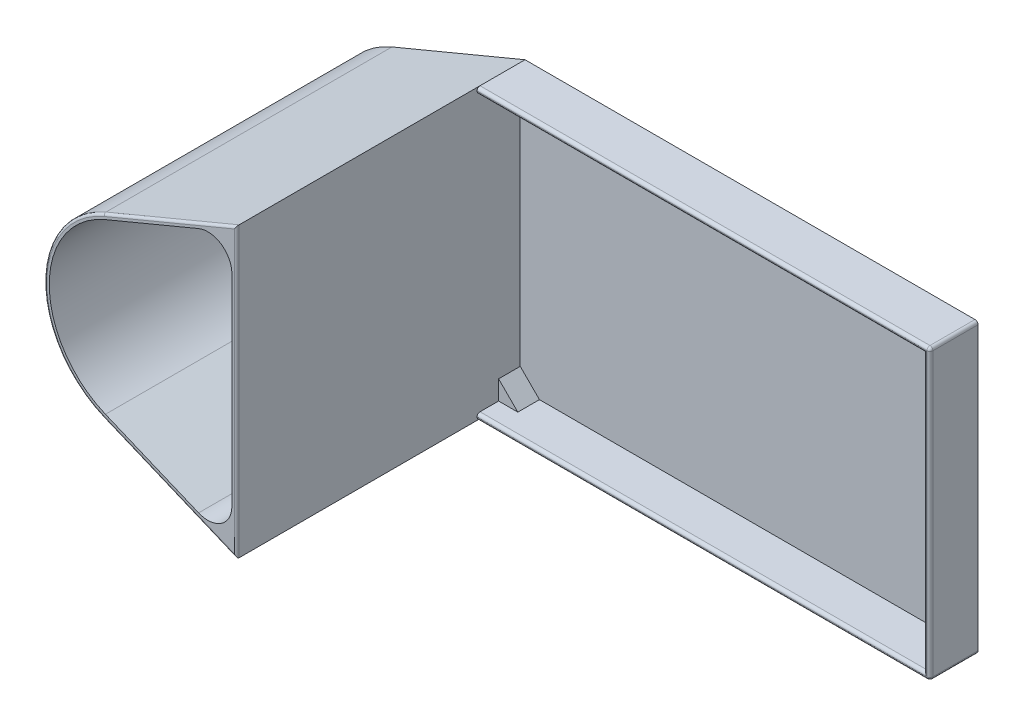
from build123d import *

# Parameters (mm, degrees)
SZKIC1_W                    = 95.25
SZKIC1_H                    = 60
DODANIE_WYCI_GNI_CIE1_DEPTH = 10
SZKIC2_W                    = 93
SZKIC2_H                    = 57.5
WYTNIJ_WYCI_GNI_CIE1_DEPTH  = 9
DODANIE_WYCI_GNI_CIE3_DEPTH = 60
WYTNIJ_WYCI_GNI_CIE2_REACH  = 106.318
DODANIE_WYCI_GNI_CIE4_DEPTH = 1
ZAOKR_GLENIE1_R             = 0.63
ZAOKR_GLENIE2_R             = 5
ZAOKR_GLENIE3_R             = 0.5
DODANIE_WYCI_GNI_CIE2_DEPTH = 4.5
ZAOKR_GLENIE4_R             = 4


with BuildPart() as part:
    # Szkic1 → Dodanie-wyciągnięcie1 (new body)
    with BuildSketch(Plane.XY):
        with Locations((0.125, 0)):
            Rectangle(SZKIC1_W, SZKIC1_H)
    extrude(amount=DODANIE_WYCI_GNI_CIE1_DEPTH)

    # Szkic2 → Wytnij-wyciągnięcie1 (cut)
    with BuildSketch(Plane.XY.offset(10)):
        Rectangle(SZKIC2_W, SZKIC2_H)
    extrude(amount=-WYTNIJ_WYCI_GNI_CIE1_DEPTH, mode=Mode.SUBTRACT)

    # Szkic4 → Dodanie-wyciągnięcie3 (add)
    with BuildSketch(Plane.XY):
        with BuildLine():
            Line((-46.5, -30), (-74.192307692, -18.461538462))
            ThreePointArc((-74.192307692, -18.461538462), (-86.5, 0), (-74.192307692, 18.461538462))
            Line((-74.192307692, 18.461538462), (-46.5, 30))
            Line((-46.5, 30), (-46.5, -30))
        make_face()
        with BuildLine():
            Line((-47.5, -28.5), (-73.807692308, -17.538461538))
            ThreePointArc((-73.807692308, -17.538461538), (-85.5, 0), (-73.807692308, 17.538461538))
            Line((-73.807692308, 17.538461538), (-47.5, 28.5))
            Line((-47.5, 28.5), (-47.5, -28.5))
        make_face(mode=Mode.SUBTRACT)
    extrude(amount=DODANIE_WYCI_GNI_CIE3_DEPTH)

    # Szkic6 → Wytnij-wyciągnięcie2 (cut, up to next)
    with BuildSketch(Plane.XY.offset(10), mode=Mode.PRIVATE) as wytnij_wyci_gni_cie2_sk1:
        Polygon((-46.5, -30), (-47.5, -29.583333333), (-47.5, -30), align=None)
    wytnij_wyci_gni_cie2_tool1 = extrude(wytnij_wyci_gni_cie2_sk1.sketch, amount=-WYTNIJ_WYCI_GNI_CIE2_REACH, mode=Mode.PRIVATE) & part.part
    # Szkic6 → Wytnij-wyciągnięcie2 (cut, up to next)
    with BuildSketch(Plane.XY.offset(10), mode=Mode.PRIVATE) as wytnij_wyci_gni_cie2_sk2:
        Polygon((-46.5, 30), (-47.5, 29.583333333), (-47.5, 30), align=None)
    wytnij_wyci_gni_cie2_tool2 = extrude(wytnij_wyci_gni_cie2_sk2.sketch, amount=-WYTNIJ_WYCI_GNI_CIE2_REACH, mode=Mode.PRIVATE) & part.part
    add(wytnij_wyci_gni_cie2_tool1.solids().sort_by_distance((-47.166667, -29.861111, 10))[0], mode=Mode.SUBTRACT)
    add(wytnij_wyci_gni_cie2_tool2.solids().sort_by_distance((-47.166667, 29.861111, 10))[0], mode=Mode.SUBTRACT)

    # Szkic5 → Dodanie-wyciągnięcie4 (add)
    with BuildSketch(Plane(origin=(0, 0, 0), x_dir=(-1, 0, 0), z_dir=(0, 0, -1))):
        with BuildLine():
            Line((73.807692308, -17.538461538), (47.5, -28.5))
            Line((47.5, -28.5), (47.5, 28.5))
            Line((47.5, 28.5), (73.807692308, 17.538461538))
            ThreePointArc((73.807692308, 17.538461538), (85.5, 0), (73.807692308, -17.538461538))
        make_face()
    extrude(amount=-DODANIE_WYCI_GNI_CIE4_DEPTH)

    # Zaokrąglenie1
    # the kernel refuses this fillet: 0.63 mm, written as the material it takes off along each edge
    with BuildSketch(Plane(origin=(47.12, 29.37, 9.37), x_dir=(1, 0, 0), z_dir=(0, 1, 0))) as zaokr_glenie1_piece_1_section:
        Polygon((0, 0), (ZAOKR_GLENIE1_R * 1.02, 0), (ZAOKR_GLENIE1_R * 1.02, -ZAOKR_GLENIE1_R * 1.02), (0, -ZAOKR_GLENIE1_R * 1.02), align=None)
    zaokr_glenie1_piece_1 = extrude(amount=ZAOKR_GLENIE1_R * 1.02, mode=Mode.PRIVATE)
    zaokr_glenie1_piece_1 = zaokr_glenie1_piece_1 - Plane(origin=(47.12, 29.37, 9.37), x_dir=(-0.7071067811865475, 0, -0.7071067811865475), z_dir=(0, 1, 0)) * Sphere(ZAOKR_GLENIE1_R, mode=Mode.PRIVATE)
    add(zaokr_glenie1_piece_1, mode=Mode.SUBTRACT)
    with BuildSketch(Plane(origin=(47.12, -29.37, 9.37), x_dir=(0, 0, 1), z_dir=(1, 0, 0))) as zaokr_glenie1_piece_2_section:
        Polygon((0, 0), (ZAOKR_GLENIE1_R * 1.02, 0), (ZAOKR_GLENIE1_R * 1.02, ZAOKR_GLENIE1_R * 1.02), (0, ZAOKR_GLENIE1_R * 1.02), align=None)
    zaokr_glenie1_piece_2 = extrude(amount=ZAOKR_GLENIE1_R * 1.02, mode=Mode.PRIVATE)
    zaokr_glenie1_piece_2 = zaokr_glenie1_piece_2 - Plane(origin=(47.12, -29.37, 9.37), x_dir=(0, 0.7071067811865475, -0.7071067811865475), z_dir=(1, 0, 0)) * Sphere(ZAOKR_GLENIE1_R, mode=Mode.PRIVATE)
    add(zaokr_glenie1_piece_2, mode=Mode.SUBTRACT)
    with BuildSketch(Plane(origin=(47.75, 30, -1.575), x_dir=(-1, 0, 0), z_dir=(0, 0, 1)), Plane(origin=(47.75, -30, -1.575), x_dir=(0, 1, 0), z_dir=(0, 0, 1))) as zaokr_glenie1_piece_3:
        with BuildLine():
            CenterArc((ZAOKR_GLENIE1_R, ZAOKR_GLENIE1_R), ZAOKR_GLENIE1_R, 180, 90)
            Line((0, ZAOKR_GLENIE1_R), (0, 0))
            Line((0, 0), (ZAOKR_GLENIE1_R, 0))
        make_face()
    extrude(amount=10.945, mode=Mode.SUBTRACT)
    with BuildSketch(Plane(origin=(-46.5, 30, 10), x_dir=(0, 0, -1), z_dir=(1, 0, 0))) as zaokr_glenie1_piece_4:
        with BuildLine():
            CenterArc((ZAOKR_GLENIE1_R, -ZAOKR_GLENIE1_R), ZAOKR_GLENIE1_R, 90, 90)
            Line((0, -ZAOKR_GLENIE1_R), (0, 0))
            Line((0, 0), (ZAOKR_GLENIE1_R, 0))
        make_face()
    extrude(amount=93.62, mode=Mode.SUBTRACT)
    with BuildSketch(Plane(origin=(47.75, 29.37, 10), x_dir=(0, 0, -1), z_dir=(0, -1, 0))) as zaokr_glenie1_piece_5:
        with BuildLine():
            CenterArc((ZAOKR_GLENIE1_R, -ZAOKR_GLENIE1_R), ZAOKR_GLENIE1_R, 90, 90)
            Line((0, -ZAOKR_GLENIE1_R), (0, 0))
            Line((0, 0), (ZAOKR_GLENIE1_R, 0))
        make_face()
    extrude(amount=58.74, mode=Mode.SUBTRACT)
    with BuildSketch(Plane(origin=(47.12, -30, 10), x_dir=(0, 1, 0), z_dir=(-1, 0, 0))) as zaokr_glenie1_piece_6:
        with BuildLine():
            CenterArc((ZAOKR_GLENIE1_R, ZAOKR_GLENIE1_R), ZAOKR_GLENIE1_R, 180, 90)
            Line((0, ZAOKR_GLENIE1_R), (0, 0))
            Line((0, 0), (ZAOKR_GLENIE1_R, 0))
        make_face()
    extrude(amount=93.62, mode=Mode.SUBTRACT)
    with BuildSketch(Plane(origin=(46.5, 28.75, 10), x_dir=(1, 0, 0), z_dir=(0, -1, 0))) as zaokr_glenie1_piece_7:
        with BuildLine():
            CenterArc((ZAOKR_GLENIE1_R, -ZAOKR_GLENIE1_R), ZAOKR_GLENIE1_R, 90, 90)
            Line((0, -ZAOKR_GLENIE1_R), (0, 0))
            Line((0, 0), (ZAOKR_GLENIE1_R, 0))
        make_face()
    extrude(amount=57.5, mode=Mode.SUBTRACT)
    with BuildSketch(Plane(origin=(-46.5, 28.75, 10), x_dir=(0, 1, 0), z_dir=(1, 0, 0)), Plane(origin=(46.5, -28.75, 10), x_dir=(0, -1, 0), z_dir=(-1, 0, 0))) as zaokr_glenie1_piece_8:
        with BuildLine():
            CenterArc((ZAOKR_GLENIE1_R, -ZAOKR_GLENIE1_R), ZAOKR_GLENIE1_R, 90, 90)
            Line((0, -ZAOKR_GLENIE1_R), (0, 0))
            Line((0, 0), (ZAOKR_GLENIE1_R, 0))
        make_face()
    extrude(amount=93, mode=Mode.SUBTRACT)
    with BuildSketch(Plane(origin=(-46.5, 28.75, 10), x_dir=(0, 1, 0), z_dir=(1, 0, 0))) as zaokr_glenie1_piece_9a_section:
        with BuildLine():
            CenterArc((ZAOKR_GLENIE1_R, -ZAOKR_GLENIE1_R), ZAOKR_GLENIE1_R, 90, 90)
            Line((0, -ZAOKR_GLENIE1_R), (0, 0))
            Line((0, 0), (ZAOKR_GLENIE1_R, 0))
        make_face()
    zaokr_glenie1_piece_9a = extrude(amount=94.575, mode=Mode.PRIVATE)
    zaokr_glenie1_piece_9a = split(zaokr_glenie1_piece_9a, bisect_by=Plane(origin=(47.75, 28.75, 10), z_dir=(-1, 0, 0)), keep=Keep.TOP, mode=Mode.PRIVATE)
    zaokr_glenie1_piece_9a = split(zaokr_glenie1_piece_9a, bisect_by=Plane(origin=(46.5, 28.75, 10), z_dir=(1, 0, 0)), keep=Keep.TOP, mode=Mode.PRIVATE)
    with BuildSketch(Plane(origin=(46.5, 30.325, 10), x_dir=(1, 0, 0), z_dir=(0, -1, 0))) as zaokr_glenie1_piece_9b_section:
        with BuildLine():
            CenterArc((ZAOKR_GLENIE1_R, -ZAOKR_GLENIE1_R), ZAOKR_GLENIE1_R, 90, 90)
            Line((0, -ZAOKR_GLENIE1_R), (0, 0))
            Line((0, 0), (ZAOKR_GLENIE1_R, 0))
        make_face()
    zaokr_glenie1_piece_9b = extrude(amount=59.075, mode=Mode.PRIVATE)
    zaokr_glenie1_piece_9b = split(zaokr_glenie1_piece_9b, bisect_by=Plane(origin=(46.5, 30, 10), z_dir=(0, -1, 0)), keep=Keep.TOP, mode=Mode.PRIVATE)
    zaokr_glenie1_piece_9b = split(zaokr_glenie1_piece_9b, bisect_by=Plane(origin=(46.5, 28.75, 10), z_dir=(0, 1, 0)), keep=Keep.TOP, mode=Mode.PRIVATE)
    zaokr_glenie1_piece_9 = zaokr_glenie1_piece_9a & zaokr_glenie1_piece_9b
    add(zaokr_glenie1_piece_9, mode=Mode.SUBTRACT)
    with BuildSketch(Plane(origin=(46.5, 28.75, 10), x_dir=(1, 0, 0), z_dir=(0, -1, 0))) as zaokr_glenie1_piece_10a_section:
        with BuildLine():
            CenterArc((ZAOKR_GLENIE1_R, -ZAOKR_GLENIE1_R), ZAOKR_GLENIE1_R, 90, 90)
            Line((0, -ZAOKR_GLENIE1_R), (0, 0))
            Line((0, 0), (ZAOKR_GLENIE1_R, 0))
        make_face()
    zaokr_glenie1_piece_10a = extrude(amount=59.075, mode=Mode.PRIVATE)
    zaokr_glenie1_piece_10a = split(zaokr_glenie1_piece_10a, bisect_by=Plane(origin=(46.5, -30, 10), z_dir=(0, 1, 0)), keep=Keep.TOP, mode=Mode.PRIVATE)
    zaokr_glenie1_piece_10a = split(zaokr_glenie1_piece_10a, bisect_by=Plane(origin=(46.5, -28.75, 10), z_dir=(0, -1, 0)), keep=Keep.TOP, mode=Mode.PRIVATE)
    with BuildSketch(Plane(origin=(48.075, -28.75, 10), x_dir=(0, -1, 0), z_dir=(-1, 0, 0))) as zaokr_glenie1_piece_10b_section:
        with BuildLine():
            CenterArc((ZAOKR_GLENIE1_R, -ZAOKR_GLENIE1_R), ZAOKR_GLENIE1_R, 90, 90)
            Line((0, -ZAOKR_GLENIE1_R), (0, 0))
            Line((0, 0), (ZAOKR_GLENIE1_R, 0))
        make_face()
    zaokr_glenie1_piece_10b = extrude(amount=94.575, mode=Mode.PRIVATE)
    zaokr_glenie1_piece_10b = split(zaokr_glenie1_piece_10b, bisect_by=Plane(origin=(47.75, -28.75, 10), z_dir=(-1, 0, 0)), keep=Keep.TOP, mode=Mode.PRIVATE)
    zaokr_glenie1_piece_10b = split(zaokr_glenie1_piece_10b, bisect_by=Plane(origin=(46.5, -28.75, 10), z_dir=(1, 0, 0)), keep=Keep.TOP, mode=Mode.PRIVATE)
    zaokr_glenie1_piece_10 = zaokr_glenie1_piece_10a & zaokr_glenie1_piece_10b
    add(zaokr_glenie1_piece_10, mode=Mode.SUBTRACT)

    # Zaokrąglenie2
    zaokr_glenie2_edges = [part.edges().sort_by_distance(p)[0] for p in [
        (-47.5, 28.5, 30.5),
        (-47.5, -28.5, 30.5),
    ]]
    fillet(zaokr_glenie2_edges, radius=ZAOKR_GLENIE2_R)

    # Zaokrąglenie3
    zaokr_glenie3_edges = [part.edges().sort_by_distance(p)[0] for p in [
        (-86.5, 0, 60),
        (-60.346153846, -24.230769231, 60),
        (-46.5, 0, 60),
        (-60.346153846, 24.230769231, 60),
    ]]
    fillet(zaokr_glenie3_edges, radius=ZAOKR_GLENIE3_R)

    # Szkic3 → Dodanie-wyciągnięcie2 (add)
    with BuildSketch(Plane.XY.offset(1)):
        Polygon((46.5, -28.75), (46.5, -24.75), (42.5, -28.75), align=None)
        Polygon((-42.5, -28.75), (-46.5, -28.75), (-46.5, -24.75), align=None)
        Polygon((-46.5, 28.75), (-46.5, 24.75), (-42.5, 28.75), align=None)
        Polygon((42.5, 28.75), (46.5, 28.75), (46.5, 24.75), align=None)
    extrude(amount=DODANIE_WYCI_GNI_CIE2_DEPTH)

    # Zaokrąglenie4
    zaokr_glenie4_edges = [part.edges().sort_by_distance(p)[0] for p in [
        (-47.5, 0, 1),
        (-64.115384615, -21.576923077, 1),
        (-49.726499019, -25.160251472, 1),
        (-49.726499019, 25.160251472, 1),
        (-85.5, 0, 1),
        (-64.115384615, 21.576923077, 1),
    ]]
    fillet(zaokr_glenie4_edges, radius=ZAOKR_GLENIE4_R)


solid = part.part
